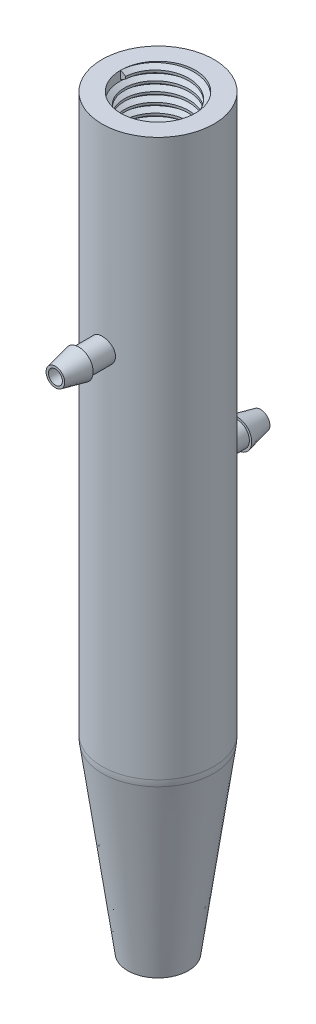
from build123d import *

# Parameters (mm, degrees)
THREAD1_PITCH           = 1
SKETCH2_R               = 0.75
CUT_EXTRUDE1_DEPTH      = 10
CUT_EXTRUDE2_REACH      = 62.466
CUT_EXTRUDE2_END_RADIUS = 6
SKETCH10_R              = 0.75


with BuildPart() as part:
    # Sketch1 → Revolve2 (revolve)
    with BuildSketch(Plane.XY, mode=Mode.PRIVATE) as revolve2_sk:
        with BuildLine():
            Line((-3.953394199, -1.185382086), (-1.25, -20.846430808))
            Line((-1.25, -20.846430808), (-3.25, -20.846430808))
            Line((-3.25, -20.846430808), (-5.953394199, -1.185382086))
            ThreePointArc((-5.953394199, -1.185382086), (-5.988334942, -0.84563259), (-6, -0.504290384))
            Line((-6, -0.504290384), (-6, 59.153569192))
            Line((-6, 59.153569192), (-4, 59.153569192))
            Line((-4, 59.153569192), (-4, -0.504290384))
            ThreePointArc((-4, -0.504290384), (-3.988334942, -0.84563259), (-3.953394199, -1.185382086))
        make_face()
    revolve(revolve2_sk.sketch.rotate(Axis((0, 20, 0), (0, -1, 0)), 270), axis=Axis((0, 20, 0), (0, -1, 0)))

    # Thread1: the profile of Thread Profile2 profile screwed along a right-hand helix of 10 turns, 8 arcs to a turn; built about Z, then put on its axis
    thread1_z = Axis((0, 0, 0), (0, 0, 1))
    thread1_corners = [(4.0003, 0, -0.000173205), (4.0003, 0, 0.875173202), (3.458734125, 0, 0.562499998), (3.458734125, 0, 0.312499998)]
    with BuildLine(mode=Mode.PRIVATE) as thread1_profile:
        Line(thread1_corners[0], thread1_corners[1])
        Line(thread1_corners[1], thread1_corners[2])
        Line(thread1_corners[2], thread1_corners[3])
        Line(thread1_corners[3], thread1_corners[0])
    thread1_cap = Face(thread1_profile.wire())
    thread1_turn_angles = [0, 22.5, 45, 67.5, 90, 112.5, 135, 157.5, 180, 202.5, 225, 247.5, 270, 292.5, 315, 337.5, 360]
    thread1_turn_weights = [1, 0.9238795325112867, 1, 0.9238795325112867, 1, 0.9238795325112867, 1, 0.9238795325112867, 1, 0.9238795325112867, 1, 0.9238795325112867, 1, 0.9238795325112867, 1, 0.9238795325112867, 1]
    thread1_turn_rails = [Edge.make_bspline([Vector(p[0], p[1], 0).rotate(thread1_z, thread1_turn_angles[k]) / thread1_turn_weights[k] + Vector(0, 0, p[2] + THREAD1_PITCH * thread1_turn_angles[k] / 360) for k in range(17)], [0, 0, 0, 1, 1, 2, 2, 3, 3, 4, 4, 5, 5, 6, 6, 7, 7, 8, 8, 8], 2, thread1_turn_weights) for p in thread1_corners]
    thread1_turn_sides = [Face.make_surface_from_curves(thread1_turn_rails[p[0]], thread1_turn_rails[p[1]]) for p in [(0, 1), (1, 2), (2, 3), (3, 0)]]
    thread1 = Plane(origin=(0, 59.153569192, 0), x_dir=(-1, 0, 0), z_dir=(0, -1, 0)) * Solid(Shell([*[p.moved(Location((0, 0, THREAD1_PITCH * i))) for i in range(10) for p in thread1_turn_sides], thread1_cap, thread1_cap.rotate(thread1_z, 3600).moved(Location((0, 0, THREAD1_PITCH * 3600 / 360)))]))
    add(thread1)

    # Sketch2 → Cut-Extrude1 (cut)
    with BuildSketch(Plane.XY):
        with Locations((0, 23.153917336)):
            Circle(SKETCH2_R)
    extrude(amount=-CUT_EXTRUDE1_DEPTH, mode=Mode.SUBTRACT)

    # Sketch8 → Revolve3 (revolve)
    with BuildSketch(Plane(origin=(0, 0, 0), x_dir=(0, 0, -1), z_dir=(1, 0, 0)), mode=Mode.PRIVATE) as revolve3_sk:
        Polygon((5.8, 23.903917336), (11, 23.903917336), (11, 24.153917336), (8.5, 24.703917336), (8.5, 24.453917336), (5.8, 24.453917336), align=None)
    revolve(revolve3_sk.sketch.rotate(Axis((0, 23.153917336, -5.151722914), (0, 0, -1)), 90), axis=Axis((0, 23.153917336, -5.151722914), (0, 0, -1)))

    # Cut-Extrude2: up to this cylinder (the profile starts inside it)
    cut_extrude2_end = Plane(origin=(0, 38.153917, 0), z_dir=(0, 1, 0)) * Cylinder(CUT_EXTRUDE2_END_RADIUS, 137.932, mode=Mode.PRIVATE)
    # Sketch10 → Cut-Extrude2 (cut, up to the surface)
    with BuildSketch(Plane.XY, mode=Mode.PRIVATE) as cut_extrude2_sk1:
        with Locations(Location((0, 38.153917336, 0), (0, 0, 180))):
            Circle(SKETCH10_R)
    cut_extrude2_tool1 = extrude(cut_extrude2_sk1.sketch, amount=CUT_EXTRUDE2_REACH, mode=Mode.PRIVATE) & cut_extrude2_end
    add(cut_extrude2_tool1.solids().sort_by_distance((0, 38.153917, 0))[0], mode=Mode.SUBTRACT)

    # Sketch11 → Revolve4 (revolve)
    with BuildSketch(Plane(origin=(0, 0, 0), x_dir=(0, 0, -1), z_dir=(1, 0, 0)), mode=Mode.PRIVATE) as revolve4_sk:
        Polygon((-5.8, 38.903917336), (-11, 38.903917336), (-11, 39.153917336), (-8.5, 39.703917336), (-8.5, 39.453917336), (-5.8, 39.453917336), align=None)
    revolve(revolve4_sk.sketch.rotate(Axis((0, 38.153917336, 4.542595833), (0, 0, 1)), 90), axis=Axis((0, 38.153917336, 4.542595833), (0, 0, 1)))


solid = part.part
